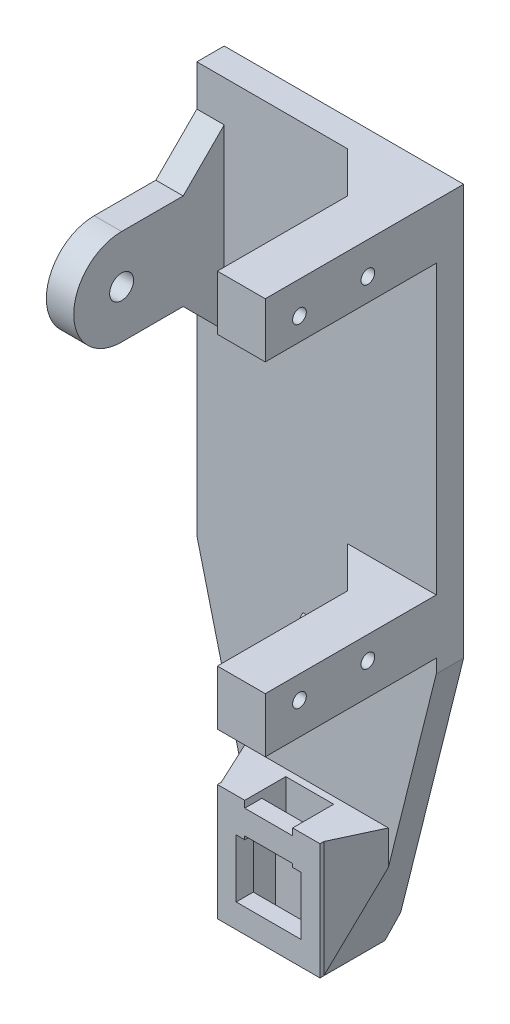
from build123d import *

# Parameters (mm, degrees)
RESSALTO_EXTRUS_O1_DEPTH    = 4
ESBO_O2_W                   = 7
ESBO_O2_H                   = 8
ESBO_O2_W_2                 = 4
ESBO_O2_H_2                 = 16
RESSALTO_EXTRUS_O2_DEPTH    = 25
CORTE_EXTRUS_O1_START       = -35
CORTE_EXTRUS_O1_OUTLINE_R   = 1.75
CORTE_EXTRUS_O1_OUTLINE_R_2 = 1
CORTE_EXTRUS_O1_DEPTH       = 35
RESSALTO_EXTRUS_O3_DEPTH    = 17
RESSALTO_EXTRUS_O4_REACH    = 106.553
ESBO_O7_W                   = 4
ESBO_O7_H                   = 5
ESBO_O8_W                   = 15
ESBO_O8_H                   = 3.5
RESSALTO_EXTRUS_O5_DEPTH    = 2.5
CHANFRO1_SIZE               = 6
CHANFRO2_SIZE               = 3
CHANFRO2_SIZE2              = 6.433520762
CHANFRO3_SIZE               = 1.5
CHANFRO3_SIZE2              = 3.216760381


# Read off the part's stored shape, not the designer's step: Corte-extrusão1
with BuildPart() as part:
    # Esboço1 → Ressalto-extrusão1 (new body)
    with BuildSketch(Plane.XY):
        Polygon((-17.5, 0), (17.5, 0), (17.5, -60), (7.5, -100), (-7.5, -100), (-17.5, -60), align=None)
    extrude(amount=RESSALTO_EXTRUS_O1_DEPTH)

    # Esboço2 → Ressalto-extrusão2 (add)
    with BuildSketch(Plane.XY.offset(4)):
        with Locations((14, -54)):
            Rectangle(ESBO_O2_W, ESBO_O2_H)
        with Locations((14, -4)):
            Rectangle(ESBO_O2_W, ESBO_O2_H)
        with Locations((-15.5, -19)):
            Rectangle(ESBO_O2_W_2, ESBO_O2_H_2)
    extrude(amount=RESSALTO_EXTRUS_O2_DEPTH)

    # Corte-extrusão1 outline → Corte-extrusão1 (cut)
    with BuildSketch(Plane(origin=(17.5, 0, 0), x_dir=(0, 0, -1), z_dir=(1, 0, 0)).offset(CORTE_EXTRUS_O1_START)):
        with Locations((-19, -18.985)):
            Circle(CORTE_EXTRUS_O1_OUTLINE_R)
        with BuildLine():
            ThreePointArc((-19, -25.985), (-26, -18.985), (-19, -11.985))
            Line((-19, -11.985), (-4, -11.985))
            Line((-4, -11.985), (-4, -11))
            Line((-4, -11), (-29, -11))
            Line((-29, -11), (-29, -27))
            Line((-29, -27), (-4, -27))
            Line((-4, -27), (-4, -25.985))
            Line((-4, -25.985), (-19, -25.985))
        make_face()
        with Locations((-24, -4.685)):
            Circle(CORTE_EXTRUS_O1_OUTLINE_R_2)
        with Locations((-14, -4.685)):
            Circle(CORTE_EXTRUS_O1_OUTLINE_R_2)
        with Locations((-14, -53.315)):
            Circle(CORTE_EXTRUS_O1_OUTLINE_R_2)
        with Locations((-24, -53.315)):
            Circle(CORTE_EXTRUS_O1_OUTLINE_R_2)
    extrude(amount=CORTE_EXTRUS_O1_DEPTH, mode=Mode.SUBTRACT)

    # Esboço6 → Ressalto-extrusão3 (add)
    with BuildSketch(Plane.XZ.offset(100)):
        Polygon((-5, 5), (-5, 8.5), (-4.75, 8.5), (-4.75, 11), (-7.5, 11), (-7.5, 4), (7.5, 4), (7.5, 11), (4.75, 11), (4.75, 8.5), (5, 8.5), (5, 5), align=None)
    extrude(amount=-RESSALTO_EXTRUS_O3_DEPTH)

    # Ressalto-extrusão4: up to this face of the body (flat: up to its plane)
    ressalto_extrus_o4_end = Plane(part.part.faces().sort_by_distance((-6.125, -91.5, 11))[0])
    # Esboço7 → Ressalto-extrusão4 (add, up to the picked face)
    with BuildSketch(Plane.XY.offset(4), mode=Mode.PRIVATE) as ressalto_extrus_o4_sk1:
        with Locations((0, -70.5)):
            Rectangle(ESBO_O7_W, ESBO_O7_H)
    ressalto_extrus_o4_tool1 = split(extrude(ressalto_extrus_o4_sk1.sketch, amount=RESSALTO_EXTRUS_O4_REACH, mode=Mode.PRIVATE), bisect_by=ressalto_extrus_o4_end, keep=Keep.BOTH, mode=Mode.PRIVATE)
    # Esboço7 → Ressalto-extrusão4 (add, up to the picked face)
    with BuildSketch(Plane.XY.offset(4), mode=Mode.PRIVATE) as ressalto_extrus_o4_sk2:
        with Locations((5.5, -85.5)):
            Rectangle(ESBO_O7_W, ESBO_O7_H)
    ressalto_extrus_o4_tool2 = split(extrude(ressalto_extrus_o4_sk2.sketch, amount=RESSALTO_EXTRUS_O4_REACH, mode=Mode.PRIVATE), bisect_by=ressalto_extrus_o4_end, keep=Keep.BOTH, mode=Mode.PRIVATE)
    # Esboço7 → Ressalto-extrusão4 (add, up to the picked face)
    with BuildSketch(Plane.XY.offset(4), mode=Mode.PRIVATE) as ressalto_extrus_o4_sk3:
        with Locations((-5.5, -85.5)):
            Rectangle(ESBO_O7_W, ESBO_O7_H)
    ressalto_extrus_o4_tool3 = split(extrude(ressalto_extrus_o4_sk3.sketch, amount=RESSALTO_EXTRUS_O4_REACH, mode=Mode.PRIVATE), bisect_by=ressalto_extrus_o4_end, keep=Keep.BOTH, mode=Mode.PRIVATE)
    add(ressalto_extrus_o4_tool1.solids().sort_by(Axis((0, -70.5, 4), (0, 0, 1)))[0])
    add(ressalto_extrus_o4_tool2.solids().sort_by(Axis((5.5, -85.5, 4), (0, 0, 1)))[0])
    add(ressalto_extrus_o4_tool3.solids().sort_by(Axis((-5.5, -85.5, 4), (0, 0, 1)))[0])

    # Esboço8 → Ressalto-extrusão5 (add)
    with BuildSketch(Plane.XY.offset(11)):
        with Locations((0, -98.25)):
            Rectangle(ESBO_O8_W, ESBO_O8_H)
        with Locations((0, -85.75)):
            Rectangle(ESBO_O8_W, ESBO_O8_H)
    extrude(amount=-RESSALTO_EXTRUS_O5_DEPTH)

    # Chanfro1
    chanfro1_edges = [part.edges().sort_by_distance(p)[0] for p in [
        (0, -68, 4),
        (10.5, -54, 4),
        (10.5, -4, 4),
        (-15.5, -11.985, 4),
        (-15.5, -25.985, 4),
    ]]
    chamfer(chanfro1_edges, length=CHANFRO1_SIZE)

    # Chanfro2
    chanfro2_edges = [part.edges().sort_by_distance(p)[0] for p in [
        (7.5, -91.5, 4),
        (-7.5, -91.5, 4),
    ]]
    chanfro2_side = [part.faces().sort_by_distance(p)[0] for p in [
        (-0.271595018, -42.597184947, 4),
    ]]
    chamfer(chanfro2_edges, length=CHANFRO2_SIZE, length2=CHANFRO2_SIZE2, reference=chanfro2_side[0])

    # Chanfro3
    chanfro3_edges = [part.edges().sort_by_distance(p)[0] for p in [
        (0, -100, 0),
    ]]
    chanfro3_side = [part.faces().sort_by_distance(p)[0] for p in [
        (7.313989248, -100, 10.716760381),
    ]]
    chamfer(chanfro3_edges, length=CHANFRO3_SIZE, length2=CHANFRO3_SIZE2, reference=chanfro3_side[0])


solid = part.part
